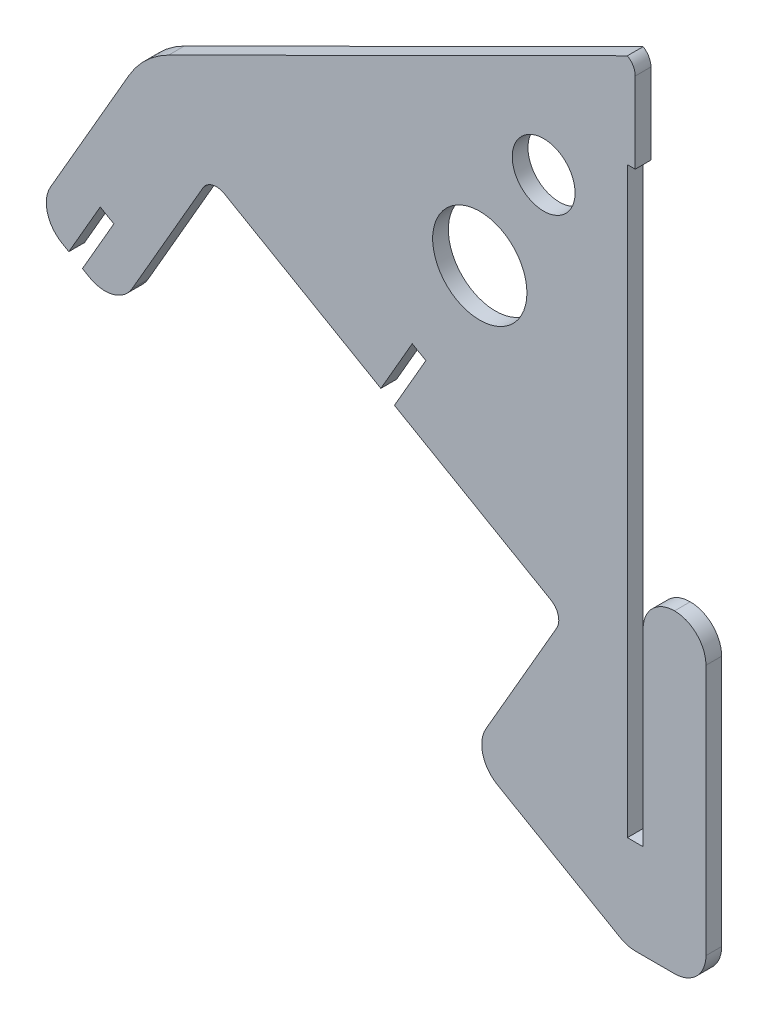
from build123d import *

# Parameters (mm, degrees)
BOSS_EXTRUDE1_DEPTH = 2.5
FILLET1_R           = 10
SKETCH2_W           = 2.5
SKETCH2_H           = 30
BOSS_EXTRUDE2_DEPTH = 5
FILLET2_R           = 5
SKETCH3_R           = 15
SKETCH3_R_2         = 10
CUT_EXTRUDE1_DEPTH  = 5
FILLET3_R           = 30
FILLET4_R           = 5


# Some blends are built 0.0001 mm under size
with BuildPart() as part:
    # Sketch1 → Boss-Extrude1 (new, symmetric)
    with BuildSketch(Plane.XY):
        Polygon((-30.132236367, -289.114804685), (19.867763633, -317.982318144), (44.867763633, -317.982318144), (44.867763633, -217.982318144), (24.867763633, -217.982318144), (24.867763633, -287.982318144), (19.867763633, -287.982318144), (19.867763633, -72.512264306), (-134.182504853, -149.335156244), (-168.696300973, -209.114804685), (-157.870983425, -215.364804685), (-147.870983425, -198.044296609), (-143.540856406, -200.544296609), (-153.540856406, -217.864804685), (-142.715538859, -224.114804685), (-112.715538859, -172.153280458), (-58.588951122, -203.403280458), (-48.588951122, -186.082772382), (-44.258824104, -188.582772382), (-54.258824104, -205.903280458), (-0.132236367, -237.153280458), align=None)
    extrude(amount=BOSS_EXTRUDE1_DEPTH, both=True)

    # Fillet1
    fillet1_edges = [part.edges().sort_by_distance(p)[0] for p in [
        (-168.696300973, -209.114804685, 0),
        (-142.715538859, -224.114804685, 0),
        (-30.132236367, -289.114804685, 0),
        (19.867763633, -317.982318144, 0),
        (24.867763633, -217.982318144, 0),
        (44.867763633, -217.982318144, 0),
        (44.867763633, -317.982318144, 0),
    ]]
    fillet(fillet1_edges, radius=FILLET1_R - 0.0001)  # a hair under: the kernel refuses the full size

    # Sketch2 → Boss-Extrude2 (add)
    with BuildSketch(Plane.XY.offset(2.5)):
        with Locations((21.117763633, -87.512264306)):
            Rectangle(SKETCH2_W, SKETCH2_H)
    extrude(amount=-BOSS_EXTRUDE2_DEPTH)

    # Fillet2
    # the kernel refuses this fillet: 5 mm, written as the material it takes off along each edge
    with BuildSketch(Plane(origin=(22.367763633, -72.512264306, 13.325317547), x_dir=(-1, 0, 0), z_dir=(0, 0, -1))) as fillet2_piece_1:
        with BuildLine():
            CenterArc((5, -4.330127019), FILLET2_R, 120, 60)
            Line((0, -4.330127019), (-0.1, -4.330127019))
            Line((-0.1, -4.330127019), (-0.1, 0))
            Line((-0.1, 0), (0, 0.1))
            ThreePointArc((0, 0.1), (1.25, 0.1), (2.45, 0.08660254))
            Line((2.45, 0.08660254), (2.5, 0))
        make_face()
    extrude(amount=26.650635095, mode=Mode.SUBTRACT)

    # Sketch3 → Cut-Extrude1 (cut)
    with BuildSketch(Plane.XY.offset(2.5)):
        with Locations((-27.097618997, -153.858693218)):
            Circle(SKETCH3_R)
        with Locations((-6.775273551, -118.659358377)):
            Circle(SKETCH3_R_2)
    extrude(amount=-CUT_EXTRUDE1_DEPTH, mode=Mode.SUBTRACT)

    # Fillet3
    fillet3_edges = [part.edges().sort_by_distance(p)[0] for p in [
        (-134.182504853, -149.335156244, 0),
    ]]
    fillet(fillet3_edges, radius=FILLET3_R)

    # Fillet4
    fillet4_edges = [part.edges().sort_by_distance(p)[0] for p in [
        (-112.715538859, -172.153280458, 0),
        (-0.132236367, -237.153280458, 0),
    ]]
    fillet(fillet4_edges, radius=FILLET4_R)


solid = part.part
